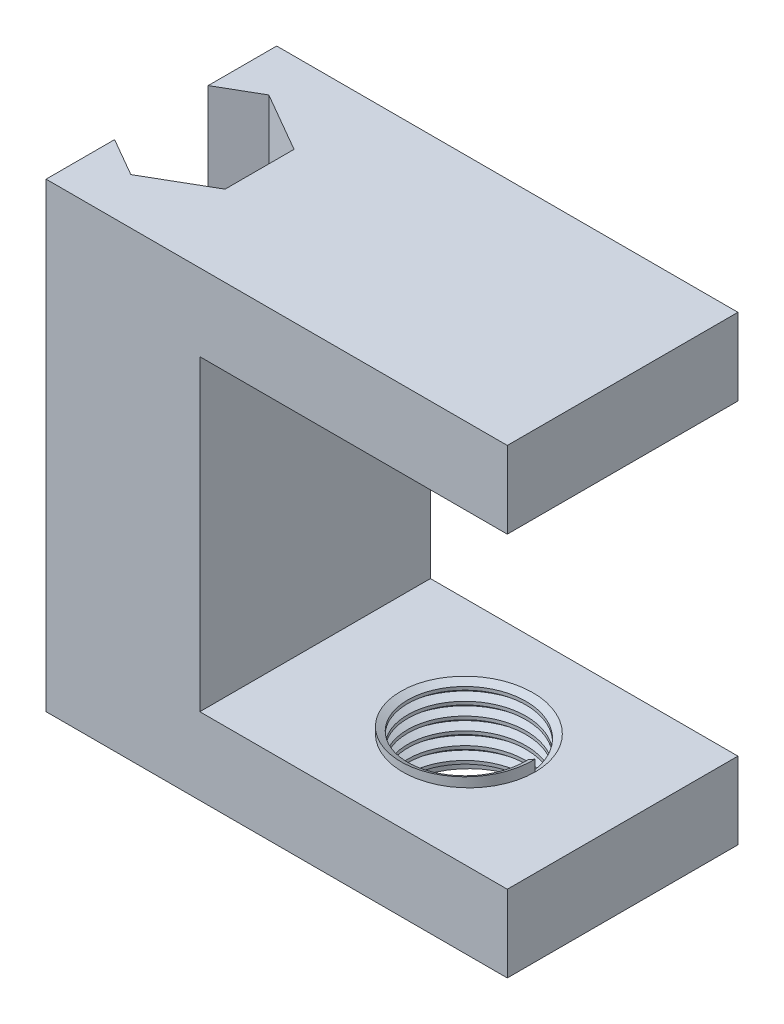
from build123d import *
from build123d.topology import SkipClean

# Parameters (mm, degrees)
SKETCH1_W           = 38.1
SKETCH1_H           = 38.1
BOSS_EXTRUDE1_DEPTH = 19.05
CUT_EXTRUDE1_REACH  = 34.996
SKETCH2_W           = 25.4
SKETCH2_H           = 25.4
CUT_EXTRUDE2_REACH  = 48.663
CUT_EXTRUDE3_DEPTH  = 31.75
CUT_EXTRUDE4_REACH  = 48.663
SKETCH5_R           = 5.461
THREAD1_PITCH       = 1.058333333


with BuildPart() as part:
    # Sketch1 → Boss-Extrude1 (new body)
    with BuildSketch(Plane.XY):
        Rectangle(SKETCH1_W, SKETCH1_H)
    extrude(amount=-BOSS_EXTRUDE1_DEPTH)

    # Sketch2 → Cut-Extrude1 (cut, up to next)
    with BuildSketch(Plane.XY, mode=Mode.PRIVATE) as cut_extrude1_sk1:
        with Locations((6.35, 0)):
            Rectangle(SKETCH2_W, SKETCH2_H)
    cut_extrude1_tool1 = extrude(cut_extrude1_sk1.sketch, amount=-CUT_EXTRUDE1_REACH, mode=Mode.PRIVATE) & part.part
    add(cut_extrude1_tool1.solids().sort_by_distance((6.35, 0, 0))[0], mode=Mode.SUBTRACT)

    # Sketch3 → Cut-Extrude2 (cut, up to next)
    with BuildSketch(Plane(origin=(0, 19.05, 0), x_dir=(1, 0, 0), z_dir=(0, 1, 0)), mode=Mode.PRIVATE) as cut_extrude2_sk1:
        Polygon((-12.7, 11.358087105), (-15.875, 13.191174209), (-19.05, 11.358087105), (-19.05, 7.691912895), (-15.875, 5.858825791), (-12.7, 7.691912895), align=None)
    cut_extrude2_tool1 = extrude(cut_extrude2_sk1.sketch, amount=-CUT_EXTRUDE2_REACH, mode=Mode.PRIVATE) & part.part
    add(cut_extrude2_tool1.solids().sort_by_distance((-15.875, 19.05, -9.525))[0], mode=Mode.SUBTRACT)

    # Sketch4 → Cut-Extrude3 (cut)
    with BuildSketch(Plane(origin=(0, 19.05, 0), x_dir=(1, 0, 0), z_dir=(0, 1, 0))):
        Polygon((-19.05, 13.390087105), (-15.875, 15.223174209), (-10.94023638, 12.374087105), (-10.94023638, 6.675912895), (-15.875, 3.826825791), (-19.05, 5.659912895), (-19.05, 7.691912895), (-15.875, 5.858825791), (-12.7, 7.691912895), (-12.7, 11.358087105), (-15.875, 13.191174209), (-19.05, 11.358087105), align=None)
    extrude(amount=-CUT_EXTRUDE3_DEPTH, mode=Mode.SUBTRACT)

    # Sketch5 → Cut-Extrude4 (cut, up to next)
    with BuildSketch(Plane.XZ.offset(19.05), mode=Mode.PRIVATE) as cut_extrude4_sk1:
        with Locations(Location((6.35, -9.525, 0), (0, 0, 270))):
            Circle(SKETCH5_R)
    cut_extrude4_tool1 = extrude(cut_extrude4_sk1.sketch, amount=-CUT_EXTRUDE4_REACH, mode=Mode.PRIVATE) & part.part
    add(cut_extrude4_tool1.solids().sort_by_distance((6.35, -19.05, -9.525))[0], mode=Mode.SUBTRACT)

    # Thread1: the profile of Thread Profile1 profile screwed along a right-hand helix of 6 turns, 8 arcs to a turn; built about Z, then put on its axis
    with SkipClean():  # the faces are left unmerged after this step: merging them gives an invalid solid
        thread1_z = Axis((0, 0, 0), (0, 0, 1))
        thread1_corners = [(5.4613, 0, -0.000173205), (5.4613, 0, 0.926214869), (4.888160282, 0, 0.595312499), (4.888160282, 0, 0.330729165)]
        with BuildLine(mode=Mode.PRIVATE) as thread1_profile:
            Line(thread1_corners[0], thread1_corners[1])
            Line(thread1_corners[1], thread1_corners[2])
            Line(thread1_corners[2], thread1_corners[3])
            Line(thread1_corners[3], thread1_corners[0])
        thread1_cap = Face(thread1_profile.wire())
        thread1_turn_angles = [0, 22.5, 45, 67.5, 90, 112.5, 135, 157.5, 180, 202.5, 225, 247.5, 270, 292.5, 315, 337.5, 360]
        thread1_turn_weights = [1, 0.9238795325112867, 1, 0.9238795325112867, 1, 0.9238795325112867, 1, 0.9238795325112867, 1, 0.9238795325112867, 1, 0.9238795325112867, 1, 0.9238795325112867, 1, 0.9238795325112867, 1]
        thread1_turn_rails = [Edge.make_bspline([Vector(p[0], p[1], 0).rotate(thread1_z, thread1_turn_angles[k]) / thread1_turn_weights[k] + Vector(0, 0, p[2] + THREAD1_PITCH * thread1_turn_angles[k] / 360) for k in range(17)], [0, 0, 0, 1, 1, 2, 2, 3, 3, 4, 4, 5, 5, 6, 6, 7, 7, 8, 8, 8], 2, thread1_turn_weights) for p in thread1_corners]
        thread1_turn_sides = [Face.make_surface_from_curves(thread1_turn_rails[p[0]], thread1_turn_rails[p[1]]) for p in [(0, 1), (1, 2), (2, 3), (3, 0)]]
        thread1 = Plane(origin=(6.35, -19.05, -9.525), x_dir=(1, 0, 0), z_dir=(0, 1, 0)) * Solid(Shell([*[p.moved(Location((0, 0, THREAD1_PITCH * i))) for i in range(6) for p in thread1_turn_sides], thread1_cap, thread1_cap.rotate(thread1_z, 2160).moved(Location((0, 0, THREAD1_PITCH * 2160 / 360)))]))
        add(thread1)


solid = part.part
